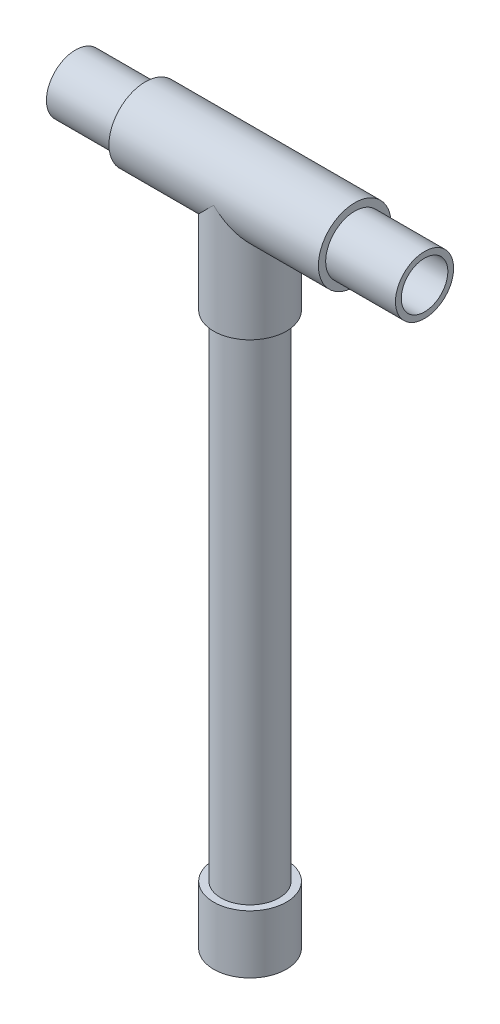
from build123d import *


with BuildPart() as part:
    # 草图1 → Revolve 394 (revolve)
    with BuildSketch(Plane.XY):
        Polygon((-12.5, 0), (-12.5, -37.5), (-10, -37.5), (-10, -207.5), (-12.5, -207.5), (-12.5, -227.5), (0, -227.5), (0, -207.591623727), (-8, -207.591623727), (-8, 0), align=None)
    revolve(axis=Axis((0, -1459.557248463, 0), (0, 1, 0)))


with BuildPart() as revolve_813_tool:
    # 草图3 → Revolve 813 (revolve)
    with BuildSketch(Plane(origin=(0, 0, 0), x_dir=(1, 0, 0), z_dir=(0, 1, 0))):
        Polygon((-60, 10), (-40, 10), (-36, 10), (-36, 12.5), (36, 12.5), (36, 10), (60, 10), (60, 8), (-60, 8), align=None)
    revolve(axis=Axis((60, 0, 0), (1, 0, 0)))


with BuildPart() as part_1:
    add(part.part)


with BuildPart() as part_2:
    # Revolve 813: joined with revolve_813_tool
    add(part_1.part.fuse(revolve_813_tool.part, tol=0.00001))


solid = part_2.part
